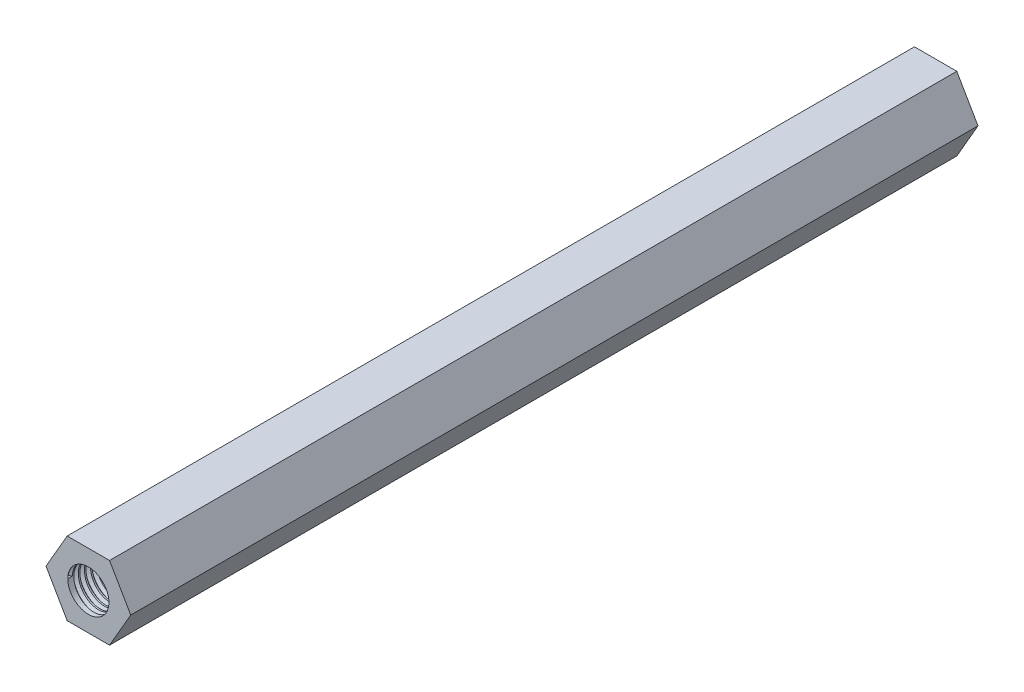
from build123d import *

# Parameters (mm, degrees)
BOSS_EXTRU_1_DEPTH   = 70
D_GAGEMENT_M31_D     = 3.4
D_GAGEMENT_M31_DEPTH = 8
D_GAGEMENT_M31_TIP   = 1.021463052
FILETAGE1_PITCH      = 0.5
D_GAGEMENT_M32_D     = 3.4
D_GAGEMENT_M32_DEPTH = 10
D_GAGEMENT_M32_TIP   = 1.021463052


with BuildPart() as part:
    # Esquisse1 → Boss.-Extru.1 (new body)
    with BuildSketch(Plane.XY):
        Polygon((5.25, 0.468911087), (7, 3.5), (5.25, 6.531088913), (1.75, 6.531088913), (0, 3.5), (1.75, 0.468911087), align=None)
    extrude(amount=BOSS_EXTRU_1_DEPTH)

    # Dégagement M31
    with Locations(Plane.XY.offset(70)):
        with Locations((3.5, 3.5)):
            Hole(D_GAGEMENT_M31_D / 2, depth=D_GAGEMENT_M31_DEPTH)
            with Locations((0, 0, -(D_GAGEMENT_M31_DEPTH + D_GAGEMENT_M31_TIP / 2))):  # 118° drill point
                Cone(0, D_GAGEMENT_M31_D / 2, D_GAGEMENT_M31_TIP, mode=Mode.SUBTRACT)

    # Filetage1: the profile of Profil de filetage1 profile screwed along a right-hand helix of 20 turns, 6 arcs to a turn; built about Z, then put on its axis
    filetage1_z = Axis((0, 0, 0), (0, 0, 1))
    filetage1_corners = [(1.6997, 0, -0.000173205), (1.970632937, 0, 0.156249999), (1.970632937, 0, 0.218749999), (1.6997, 0, 0.375173204)]
    with BuildLine(mode=Mode.PRIVATE) as filetage1_profile:
        Line(filetage1_corners[0], filetage1_corners[1])
        Line(filetage1_corners[1], filetage1_corners[2])
        Line(filetage1_corners[2], filetage1_corners[3])
        Line(filetage1_corners[3], filetage1_corners[0])
    filetage1_cap = Face(filetage1_profile.wire())
    filetage1_turn_angles = [0, 30, 60, 90, 120, 150, 180, 210, 240, 270, 300, 330, 360]
    filetage1_turn_weights = [1, 0.8660254037844387, 1, 0.8660254037844387, 1, 0.8660254037844387, 1, 0.8660254037844387, 1, 0.8660254037844387, 1, 0.8660254037844387, 1]
    filetage1_turn_rails = [Edge.make_bspline([Vector(p[0], p[1], 0).rotate(filetage1_z, filetage1_turn_angles[k]) / filetage1_turn_weights[k] + Vector(0, 0, p[2] + FILETAGE1_PITCH * filetage1_turn_angles[k] / 360) for k in range(13)], [0, 0, 0, 1, 1, 2, 2, 3, 3, 4, 4, 5, 5, 6, 6, 6], 2, filetage1_turn_weights) for p in filetage1_corners]
    filetage1_turn_sides = [Face.make_surface_from_curves(filetage1_turn_rails[p[0]], filetage1_turn_rails[p[1]]) for p in [(0, 1), (1, 2), (2, 3), (3, 0)]]
    filetage1 = Plane(origin=(3.5, 3.5, 70), x_dir=(-1, 0, 0), z_dir=(0, 0, -1)) * Solid(Shell([*[p.moved(Location((0, 0, FILETAGE1_PITCH * i))) for i in range(20) for p in filetage1_turn_sides], filetage1_cap, filetage1_cap.rotate(filetage1_z, 7200).moved(Location((0, 0, FILETAGE1_PITCH * 7200 / 360)))]))
    add(filetage1, mode=Mode.SUBTRACT)

    # Dégagement M32
    with Locations(Plane(origin=(0, 0, 0), x_dir=(-1, 0, 0), z_dir=(0, 0, -1))):
        with Locations((-3.5, 3.5)):
            Hole(D_GAGEMENT_M32_D / 2, depth=D_GAGEMENT_M32_DEPTH)
            with Locations((0, 0, -(D_GAGEMENT_M32_DEPTH + D_GAGEMENT_M32_TIP / 2))):  # 118° drill point
                Cone(0, D_GAGEMENT_M32_D / 2, D_GAGEMENT_M32_TIP, mode=Mode.SUBTRACT)


solid = part.part
